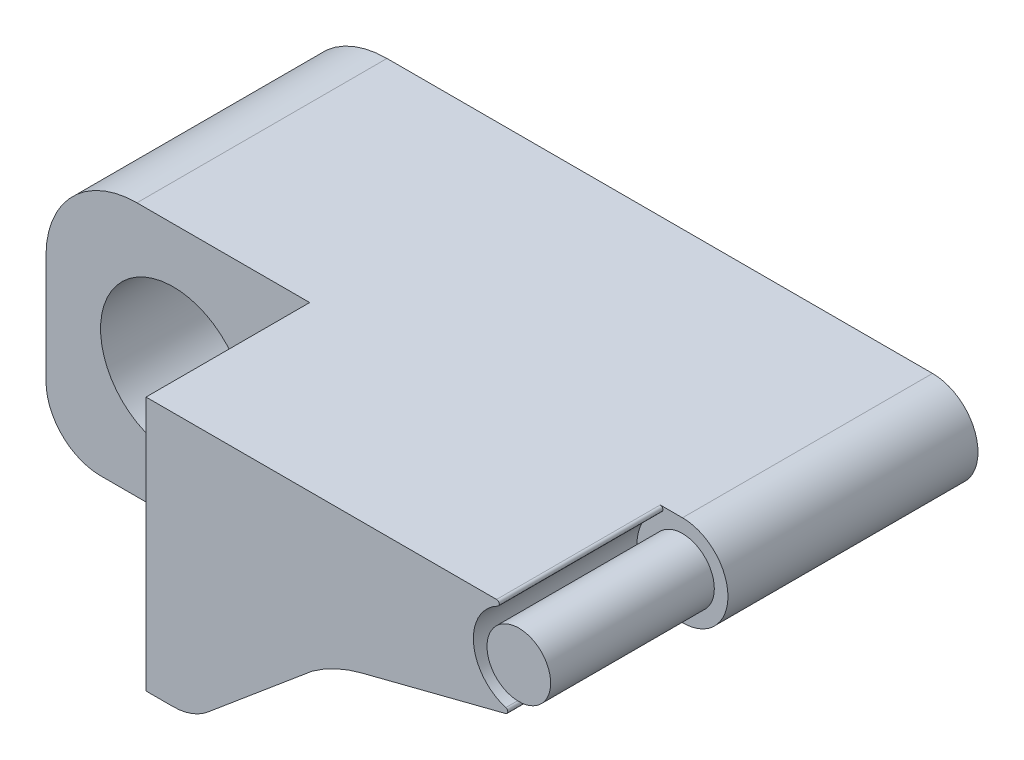
from build123d import *

# Parameters (mm, degrees)
SKETCH1_R           = 8
SKETCH1_R_2         = 5
SKETCH1_R_3         = 3.5
BOSS_EXTRUDE1_DEPTH = 48.5
BOSS_EXTRUDE2_START = 18
SKETCH3_R           = 3.5
BOSS_EXTRUDE2_DEPTH = 18
FILLET1_DEPTH       = 19
CUT_EXTRUDE1_START  = -30.5
CUT_EXTRUDE1_DEPTH  = 30.5
BOSS_EXTRUDE3_DEPTH = 9.5


with BuildPart() as part:
    # Sketch1 → Boss-Extrude1 (new body)
    # profile 1 of 4: a face of its own
    with BuildSketch(Plane.XY):
        with BuildLine():
            Line((15, -14), (17.94787914, -14))
            ThreePointArc((17.94787914, -14), (20, -13.638155725), (21.804604798, -12.596266659))
            Line((21.804604798, -12.596266659), (33.266394429, -2.978683207))
            ThreePointArc((33.266394429, -2.978683207), (35.857071693, -1.449912319), (38.688110115, -0.433068885))
            Line((38.688110115, -0.433068885), (56, 4))
            ThreePointArc((56, 4), (51, 9), (56, 14))
            Line((56, 14), (15, 14))
            Line((15, 14), (15, -14))
        make_face()
    # profile 2 of 4: a face of its own
    with BuildSketch(Plane.XY):
        with BuildLine():
            Line((-8, -14), (15, -14))
            Line((15, -14), (15, 14))
            Line((15, 14), (-4, 14))
            ThreePointArc((-4, 14), (-11.071067812, 11.071067812), (-14, 4))
            Line((-14, 4), (-14, -8))
            ThreePointArc((-14, -8), (-12.242640687, -12.242640687), (-8, -14))
        make_face()
        Circle(SKETCH1_R, mode=Mode.SUBTRACT)
    # profile 3 of 4: a face of its own
    with BuildSketch(Plane.XY):
        with Locations((56, 9)):
            Circle(SKETCH1_R_2)
        with Locations((56, 9)):
            Circle(SKETCH1_R_3, mode=Mode.SUBTRACT)
    # profile 4 of 4: a face of its own
    with BuildSketch(Plane.XY):
        with Locations((56, 9)):
            Circle(SKETCH1_R_3)
    extrude(amount=-BOSS_EXTRUDE1_DEPTH)

    # Sketch3 → Boss-Extrude2 (add)
    with BuildSketch(Plane.XY.offset(BOSS_EXTRUDE2_START)):
        with BuildLine():
            Line((38.688110115, -0.433068885), (56, 4))
            ThreePointArc((56, 4), (51, 9), (56, 14))
            Line((56, 14), (15, 14))
            Line((15, 14), (15, -14))
            Line((15, -14), (17.94787914, -14))
            ThreePointArc((17.94787914, -14), (20, -13.638155725), (21.804604798, -12.596266659))
            Line((21.804604798, -12.596266659), (33.266394429, -2.978683207))
            ThreePointArc((33.266394429, -2.978683207), (35.857071693, -1.449912319), (38.688110115, -0.433068885))
        make_face()
        with Locations((56, 9)):
            Circle(SKETCH3_R)
    extrude(amount=-BOSS_EXTRUDE2_DEPTH)

    # Fillet1: read off the stored shape, not the designer's step
    # Fillet1 outline → Fillet1 (cut)
    with BuildSketch(Plane.XY):
        with BuildLine():
            ThreePointArc((56, 4), (55.277287525, 4.052507031), (54.569754044, 4.208925329))
            ThreePointArc((54.569754044, 4.208925329), (54.783881024, 3.915548669), (54.55835931, 3.630837966))
            Line((54.55835931, 3.630837966), (56, 4))
        make_face()
        with BuildLine():
            ThreePointArc((53.550510257, 14), (53.841896016, 13.771374643), (53.68916062, 13.433962264))
            ThreePointArc((53.68916062, 13.433962264), (54.810422621, 13.856429312), (56, 14))
            Line((56, 14), (53.550510257, 14))
        make_face()
    extrude(amount=FILLET1_DEPTH, mode=Mode.SUBTRACT)

    # Sketch6 → Cut-Extrude1 (cut)
    with BuildSketch(Plane(origin=(0, 0, -48.5), x_dir=(-1, 0, 0), z_dir=(0, 0, -1)).offset(CUT_EXTRUDE1_START)):
        with BuildLine():
            Line((-33.266394429, -2.978683207), (-21.804604798, -12.596266659))
            ThreePointArc((-21.804604798, -12.596266659), (-20, -13.638155725), (-17.94787914, -14))
            Line((-17.94787914, -14), (8, -14))
            ThreePointArc((8, -14), (12.242640687, -12.242640687), (14, -8))
            Line((14, -8), (14, 4))
            ThreePointArc((14, 4), (11.071067812, 11.071067812), (4, 14))
            Line((4, 14), (-56, 14))
            ThreePointArc((-56, 14), (-61, 9), (-56, 4))
            Line((-56, 4), (-38.688110115, -0.433068885))
            ThreePointArc((-38.688110115, -0.433068885), (-35.857071693, -1.449912319), (-33.266394429, -2.978683207))
        make_face()
    extrude(amount=CUT_EXTRUDE1_DEPTH, mode=Mode.SUBTRACT)

    # Sketch7 → Boss-Extrude3 (add)
    with BuildSketch(Plane(origin=(0, 0, -18), x_dir=(-1, 0, 0), z_dir=(0, 0, -1))):
        with BuildLine():
            Line((-33.266394429, -2.978683207), (-21.804604798, -12.596266659))
            ThreePointArc((-21.804604798, -12.596266659), (-20, -13.638155725), (-17.94787914, -14))
            Line((-17.94787914, -14), (8, -14))
            ThreePointArc((8, -14), (12.242640687, -12.242640687), (14, -8))
            Line((14, -8), (14, 4))
            ThreePointArc((14, 4), (11.071067812, 11.071067812), (4, 14))
            Line((4, 14), (-56, 14))
            ThreePointArc((-56, 14), (-61, 9), (-56, 4))
            Line((-56, 4), (-38.688110115, -0.433068885))
            ThreePointArc((-38.688110115, -0.433068885), (-35.857071693, -1.449912319), (-33.266394429, -2.978683207))
        make_face()
    extrude(amount=BOSS_EXTRUDE3_DEPTH)


solid = part.part
